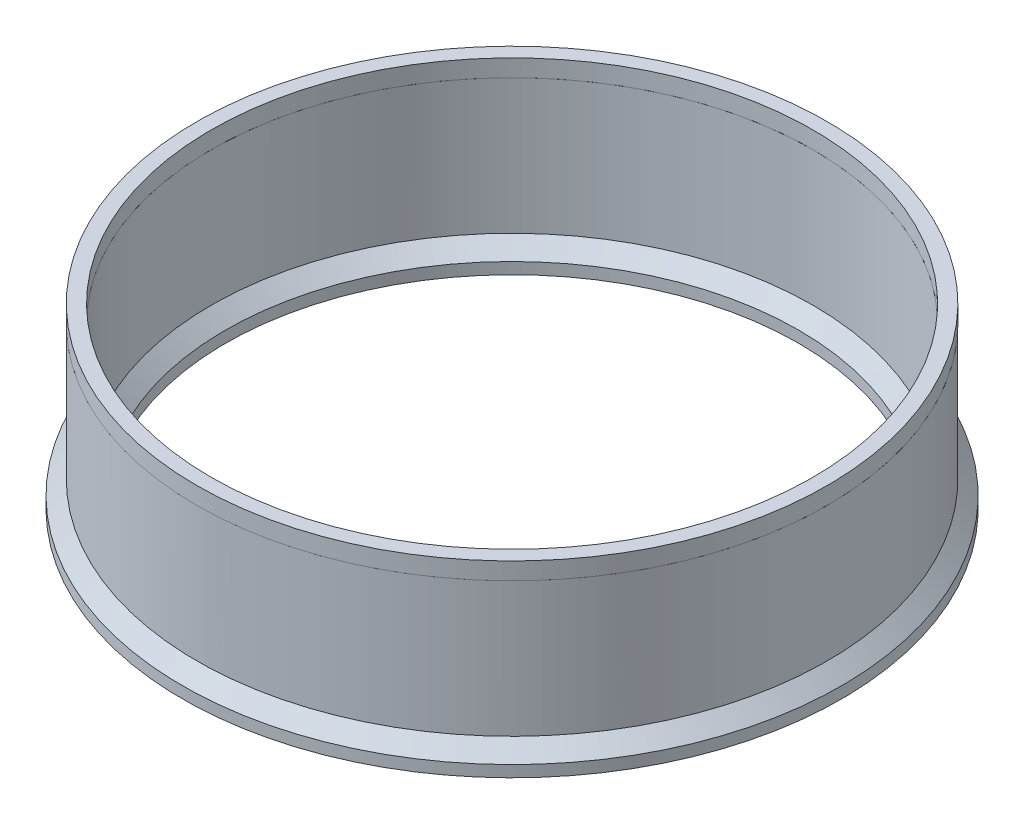
from build123d import *

# Parameters (mm, degrees)
SKETCH1_R           = 55
SKETCH1_R_2         = 52.5
BOSS_EXTRUDE1_DEPTH = 14
SKETCH2_R           = 57.5
SKETCH2_R_2         = 50
BOSS_EXTRUDE2_DEPTH = 2
CHAMFER1_SIZE       = 2.5
SKETCH3_R           = 55
SKETCH3_R_2         = 52.5
BOSS_EXTRUDE3_DEPTH = 3


with BuildPart() as part:
    # Sketch1 → Boss-Extrude1 (new, symmetric)
    with BuildSketch(Plane(origin=(0, 0, 0), x_dir=(1, 0, 0), z_dir=(0, 1, 0))):
        with Locations(Location((0, 0, 0), (0, 0, 270))):
            Circle(SKETCH1_R)
        with Locations(Location((0, 0, 0), (0, 0, 270))):
            Circle(SKETCH1_R_2, mode=Mode.SUBTRACT)
    extrude(amount=BOSS_EXTRUDE1_DEPTH, both=True)

    # Sketch2 → Boss-Extrude2 (add)
    with BuildSketch(Plane.XZ.offset(14)):
        with Locations(Location((0, 0, 0), (0, 0, 270))):
            Circle(SKETCH2_R)
        with Locations(Location((0, 0, 0), (0, 0, 270))):
            Circle(SKETCH2_R_2, mode=Mode.SUBTRACT)
    extrude(amount=-BOSS_EXTRUDE2_DEPTH)

    # Chamfer1
    chamfer1_edges = [part.edges().sort_by_distance(p)[0] for p in [
        (0, -12, -55),
        (0, -12, -52.5),
    ]]
    chamfer(chamfer1_edges, length=CHAMFER1_SIZE - 0.0001)  # a hair under: the kernel refuses the full size


with BuildPart() as body_2:
    # Sketch3 → Boss-Extrude3 (new body)
    with BuildSketch(Plane(origin=(0, 14, 0), x_dir=(1, 0, 0), z_dir=(0, 1, 0))):
        with Locations(Location((0, 0, 0), (0, 0, 270))):
            Circle(SKETCH3_R)
        with Locations(Location((0, 0, 0), (0, 0, 270))):
            Circle(SKETCH3_R_2, mode=Mode.SUBTRACT)
    extrude(amount=BOSS_EXTRUDE3_DEPTH)


solid = Compound([part.part, body_2.part])
